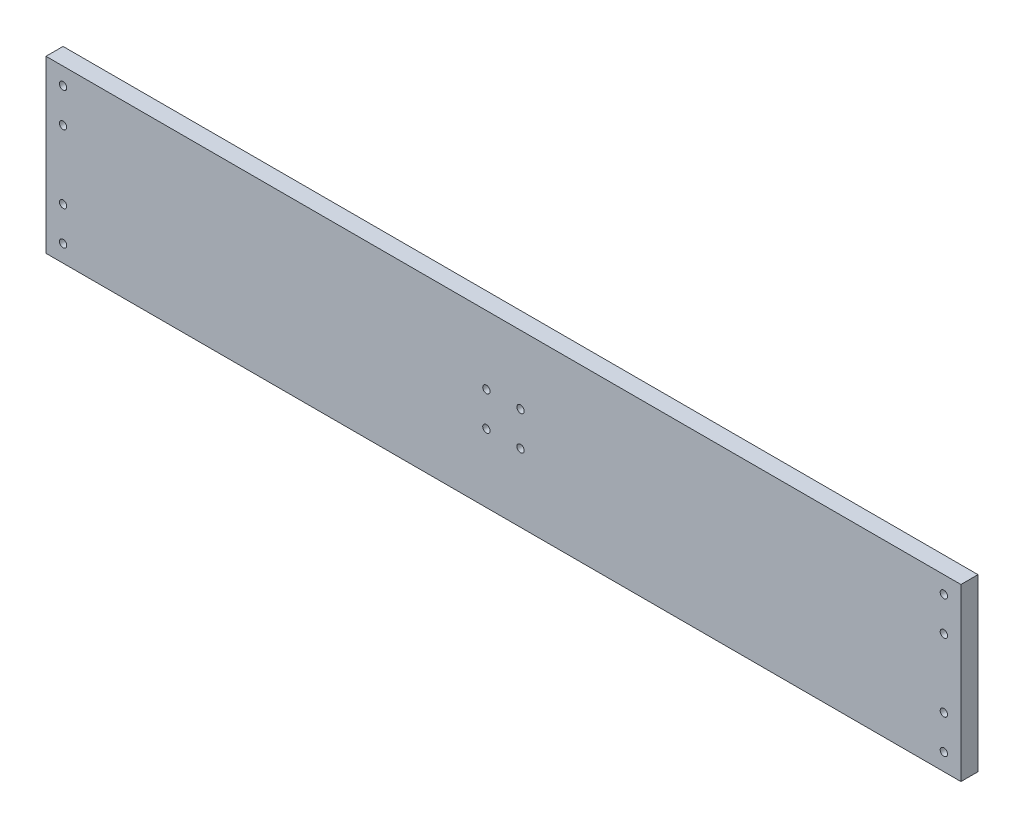
from build123d import *

# Parameters (mm, degrees)
SCHIZZO1_W                   = 536
SCHIZZO1_H                   = 100
SCHIZZO1_R                   = 2.15
ESTRUSIONE_ESTRUSIONE1_DEPTH = 10
SCHIZZO2_R                   = 2.15
TAGLIO_ESTRUSIONE1_DEPTH     = 546.340260755


with BuildPart() as part:
    # Schizzo1 → Estrusione-Estrusione1 (new body)
    with BuildSketch(Plane.XY):
        with Locations((268, 50)):
            Rectangle(SCHIZZO1_W, SCHIZZO1_H)
        with Locations((10, 90)):
            Circle(SCHIZZO1_R, mode=Mode.SUBTRACT)
        with Locations((10, 70)):
            Circle(SCHIZZO1_R, mode=Mode.SUBTRACT)
        with Locations((10, 30)):
            Circle(SCHIZZO1_R, mode=Mode.SUBTRACT)
        with Locations((526, 10)):
            Circle(SCHIZZO1_R, mode=Mode.SUBTRACT)
        with Locations((526, 30)):
            Circle(SCHIZZO1_R, mode=Mode.SUBTRACT)
        with Locations((526, 70)):
            Circle(SCHIZZO1_R, mode=Mode.SUBTRACT)
        with Locations((10, 10)):
            Circle(SCHIZZO1_R, mode=Mode.SUBTRACT)
        with Locations((526, 90)):
            Circle(SCHIZZO1_R, mode=Mode.SUBTRACT)
    extrude(amount=-ESTRUSIONE_ESTRUSIONE1_DEPTH)

    # Schizzo2 → Taglio-Estrusione1 (cut, through all)
    with BuildSketch(Plane.XY):
        with Locations((258, 60)):
            Circle(SCHIZZO2_R)
        with Locations((278, 60)):
            Circle(SCHIZZO2_R)
        with Locations((278, 40)):
            Circle(SCHIZZO2_R)
        with Locations((258, 40)):
            Circle(SCHIZZO2_R)
    extrude(amount=-TAGLIO_ESTRUSIONE1_DEPTH, mode=Mode.SUBTRACT)


solid = part.part
